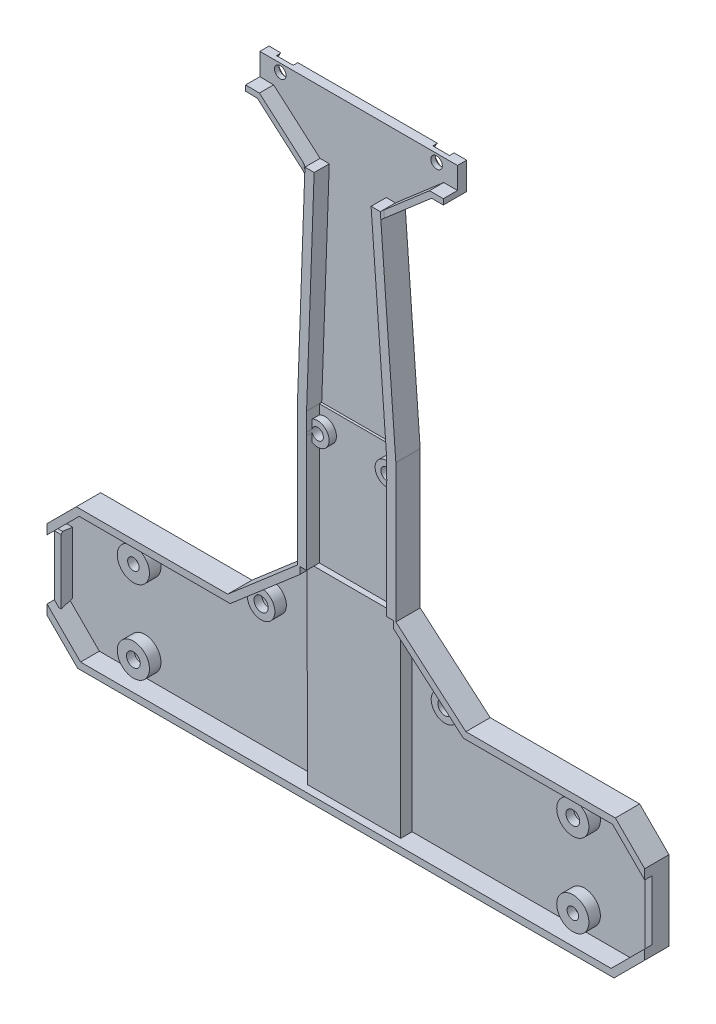
from build123d import *

# Parameters (mm, degrees)
DODANIE_WYCI_GNI_CIE2_DEPTH        = 2.5
DODANIE_WYCI_GNI_CIE2_DEPTH_BACK   = 1.59144
DODANIE_WYCI_GNI_CIE2_2_DEPTH      = 2.5
DODANIE_WYCI_GNI_CIE2_2_DEPTH_BACK = 1.59144
SZKIC2_R                           = 3.5
SZKIC2_R_2                         = 1.49999954
SZKIC2_R_3                         = 1.25000004
SZKIC2_R_4                         = 3
SZKIC2_R_5                         = 1.54999944
DODANIE_WYCI_GNI_CIE3_DEPTH        = 2.5
DODANIE_WYCI_GNI_CIE9_DEPTH        = 1.2
DODANIE_WYCI_GNI_CIE10_DEPTH       = 1.2
WYTNIJ_WYCI_GNI_CIE3_DEPTH         = 6
DODANIE_WYCI_GNI_CIE11_START       = 1.7
DODANIE_WYCI_GNI_CIE11_OUTLINE_R   = 2.25
DODANIE_WYCI_GNI_CIE11_OUTLINE_R_2 = 2.5
DODANIE_WYCI_GNI_CIE11_DEPTH       = 2
DODANIE_WYCI_GNI_CIE11_2_DEPTH     = 3.7
DODANIE_WYCI_GNI_CIE12_OUTLINE_W   = 17.422898441
DODANIE_WYCI_GNI_CIE12_OUTLINE_H   = 1.2
DODANIE_WYCI_GNI_CIE12_DEPTH       = 30
DODANIE_WYCI_GNI_CIE12_2_DEPTH     = 30
DODANIE_WYCI_GNI_CIE13_START       = -5.29144
DODANIE_WYCI_GNI_CIE13_DEPTH       = 5.29144
SZKIC12_R                          = 1.25000004
DODANIE_WYCI_GNI_CIE15_DEPTH       = 2
DODANIE_WYCI_GNI_CIE18_DEPTH       = 2
DODANIE_WYCI_GNI_CIE19_START       = -1
DODANIE_WYCI_GNI_CIE19_OUTLINE_R   = 2.5
DODANIE_WYCI_GNI_CIE19_DEPTH       = 1
DODANIE_WYCI_GNI_CIE19_START_2     = -5.29143954
DODANIE_WYCI_GNI_CIE19_2_OUTLINE_R = 1.25
DODANIE_WYCI_GNI_CIE19_2_DEPTH     = 4.29143954
DODANIE_WYCI_GNI_CIE19_START_3     = -5.09143954
DODANIE_WYCI_GNI_CIE19_3_DEPTH     = 5.09143954
ZAOKR_GLENIE1_R                    = 1
DODANIE_WYCI_GNI_CIE20_START       = -2.5
DODANIE_WYCI_GNI_CIE20_OUTLINE_R   = 1.25000004
DODANIE_WYCI_GNI_CIE20_DEPTH       = 1
DODANIE_WYCI_GNI_CIE20_2_DEPTH     = 1.59143954
DODANIE_WYCI_GNI_CIE23_DEPTH       = 1.5
SZKIC24_W                          = 2.5
SZKIC24_H                          = 15.937417509
DODANIE_WYCI_GNI_CIE24_DEPTH       = 1.5


# Read off the part's stored shape, not the designer's step: Dodanie-wyciągnięcie11, Dodanie-wyciągnięcie12, Dodanie-wyciągnięcie19, Dodanie-wyciągnięcie20
with BuildPart() as part:
    # Szkic1 → Dodanie-wyciągnięcie2 (new, two sides: drawn at the far end of the back side and taken through both)
    with BuildSketch(Plane(origin=(0, 0, -1.59143954), x_dir=(-1, 0, 0), z_dir=(0, 0, -1)).offset(-DODANIE_WYCI_GNI_CIE2_DEPTH_BACK)):
        Polygon((-50.888735278, 24.942136302), (-83.396168618, 24.950154015), (-89.775001526, 18.571321106), (-89.775001526, 16.450000763), (-82.775001526, 23.450000763), (-50.333999634, 23.441999435), (-35.099998474, 36.5), (-14.788999557, 36.5), (0.368999988, 23.441999435), (33.224998474, 23.450000763), (40.224998474, 16.450000763), (40.224998474, 18.571321106), (33.846167502, 24.950152079), (0.925846726, 24.942135087), (-14.231995352, 38), (-35.654893793, 38), align=None)
    extrude(amount=DODANIE_WYCI_GNI_CIE2_DEPTH + DODANIE_WYCI_GNI_CIE2_DEPTH_BACK)

    # Szkic2 → Dodanie-wyciągnięcie3 (add)
    # profile 1 of 8: a face of its own
    with BuildSketch(Plane(origin=(0, 0, -1.59143954), x_dir=(-1, 0, 0), z_dir=(0, 0, -1))):
        with Locations((-72.55100044, 18.79099874)):
            Circle(SZKIC2_R)
        with Locations((-72.55100044, 18.79099874)):
            Circle(SZKIC2_R_2, mode=Mode.SUBTRACT)
    # profile 2 of 8: a face of its own
    with BuildSketch(Plane(origin=(0, 0, -1.59143954), x_dir=(-1, 0, 0), z_dir=(0, 0, -1))):
        with Locations((-72.55100044, 0.79099918)):
            Circle(SZKIC2_R)
        with Locations((-72.55100044, 0.79099918)):
            Circle(SZKIC2_R_3, mode=Mode.SUBTRACT)
    # profile 3 of 8: a face of its own
    with BuildSketch(Plane(origin=(0, 0, -1.59143954), x_dir=(-1, 0, 0), z_dir=(0, 0, -1))):
        with Locations((-44.7499994, 25.6499995)):
            Circle(SZKIC2_R_4)
        with Locations((-44.7499994, 25.6499995)):
            Circle(SZKIC2_R_5, mode=Mode.SUBTRACT)
    # profile 4 of 8: a face of its own
    with BuildSketch(Plane(origin=(0, 0, -1.59143954), x_dir=(-1, 0, 0), z_dir=(0, 0, -1))):
        with Locations((-24.74999876, 34.2750013)):
            Circle(SZKIC2_R_4)
        with Locations((-24.74999876, 34.2750013)):
            Circle(SZKIC2_R_5, mode=Mode.SUBTRACT)
    # profile 5 of 8: a face of its own
    with BuildSketch(Plane(origin=(0, 0, -1.59143954), x_dir=(-1, 0, 0), z_dir=(0, 0, -1))):
        with Locations((-4.75000066, 25.1500005)):
            Circle(SZKIC2_R_4)
        with Locations((-4.75000066, 25.1500005)):
            Circle(SZKIC2_R_5, mode=Mode.SUBTRACT)
    # profile 6 of 8: a face of its own
    with BuildSketch(Plane(origin=(0, 0, -1.59143954), x_dir=(-1, 0, 0), z_dir=(0, 0, -1))):
        with Locations((23.02599916, 18.75899982)):
            Circle(SZKIC2_R)
        with Locations((23.02599916, 18.75899982)):
            Circle(SZKIC2_R_3, mode=Mode.SUBTRACT)
    # profile 7 of 8: a face of its own
    with BuildSketch(Plane(origin=(0, 0, -1.59143954), x_dir=(-1, 0, 0), z_dir=(0, 0, -1))):
        with Locations((23.02599916, 0.75900026)):
            Circle(SZKIC2_R)
        with Locations((23.02599916, 0.75900026)):
            Circle(SZKIC2_R_2, mode=Mode.SUBTRACT)
    # profile 8 of 8: a face of its own
    with BuildSketch(Plane(origin=(0, 0, -1.59143954), x_dir=(-1, 0, 0), z_dir=(0, 0, -1))):
        with Locations((-24.74999876, 5.19999976)):
            Circle(SZKIC2_R_4)
        with Locations((-24.74999876, 5.19999976)):
            Circle(SZKIC2_R_5, mode=Mode.SUBTRACT)
    extrude(amount=DODANIE_WYCI_GNI_CIE3_DEPTH)


with BuildPart() as body_2:
    # Szkic1 → Dodanie-wyci_gni_cie2 2 (new, two sides: drawn at the far end of the back side and taken through both)
    with BuildSketch(Plane(origin=(0, 0, -1.59143954), x_dir=(-1, 0, 0), z_dir=(0, 0, -1)).offset(-DODANIE_WYCI_GNI_CIE2_2_DEPTH_BACK)):
        Polygon((-89.775001526, 1.328680154), (-83.096318631, -5.349999905), (33.546319624, -5.349999905), (40.224998474, 1.3286796), (40.224998474, 3.450000048), (32.924999237, -3.849999905), (-82.474998474, -3.849999905), (-89.775001526, 3.450000048), align=None)
    extrude(amount=DODANIE_WYCI_GNI_CIE2_2_DEPTH + DODANIE_WYCI_GNI_CIE2_2_DEPTH_BACK)



with BuildPart() as dodanie_wyci_gni_cie3_piece_1:
    # of the separate pieces the step leaves, piece 1, a body of its own (dodanie_wyci_gni_cie3_pieces)
    add(part.part.solids().sort_by_distance((50.888735278, 24.942136302, -4.09143954))[0])


with BuildPart() as dodanie_wyci_gni_cie3_piece_2:
    # of the separate pieces the step leaves, piece 2, a body of its own (dodanie_wyci_gni_cie3_pieces)
    add(part.part.solids().sort_by_distance((69.05100044, 0.79099918, -1.59143954))[0])


with BuildPart() as dodanie_wyci_gni_cie3_piece_3:
    # of the separate pieces the step leaves, piece 3, a body of its own (dodanie_wyci_gni_cie3_pieces)
    add(part.part.solids().sort_by_distance((-26.52599916, 18.75899982, -1.59143954))[0])


with BuildPart() as dodanie_wyci_gni_cie3_piece_4:
    # of the separate pieces the step leaves, piece 4, a body of its own (dodanie_wyci_gni_cie3_pieces)
    add(part.part.solids().sort_by_distance((69.05100044, 18.79099874, -1.59143954))[0])


with BuildPart() as dodanie_wyci_gni_cie3_piece_5:
    # of the separate pieces the step leaves, piece 5, a body of its own (dodanie_wyci_gni_cie3_pieces)
    add(part.part.solids().sort_by_distance((-26.52599916, 0.75900026, -1.59143954))[0])


with BuildPart() as dodanie_wyci_gni_cie3_piece_6:
    # of the separate pieces the step leaves, piece 6, a body of its own (dodanie_wyci_gni_cie3_pieces)
    add(part.part.solids().sort_by_distance((21.74999876, 5.19999976, -1.59143954))[0])


with BuildPart() as body_2_1:
    add(body_2.part)

    add(dodanie_wyci_gni_cie3_piece_1.part)  # Dodanie-wyciągnięcie9 merges Dodanie-wyciągnięcie3 piece 1
    # Szkic3 → Dodanie-wyciągnięcie9 (add)
    with BuildSketch(Plane(origin=(0, 0, -4.09143954), x_dir=(-1, 0, 0), z_dir=(0, 0, -1))):
        Polygon((40.224998474, 16.450000763), (40.224998474, 18.571321106), (33.846167502, 24.950152079), (0.925846726, 24.942135087), (-14.231995352, 38), (-35.654893793, 38), (-50.888735278, 24.942136302), (-83.396168618, 24.950154015), (-89.775001526, 18.571321106), (-89.775001526, 16.450000763), (-82.775001526, 23.450000763), (-50.333999634, 23.441999435), (-47.749995418, 25.656908582), (-44.298072293, 28.615764476), (-35.099998474, 36.5), (-26.762306089, 36.5), (-22.737691431, 36.5), (-14.788999557, 36.5), (-5.075577288, 28.132281483), (-1.752380945, 25.269482893), (0.368999988, 23.441999435), (33.224998474, 23.450000763), align=None)
        Polygon((-89.775001526, 3.450000048), (-82.474998474, -3.849999905), (32.924999237, -3.849999905), (40.224998474, 3.450000048), (40.224998474, 1.3286796), (33.546319624, -5.349999905), (-83.096318631, -5.349999905), (-89.775001526, 1.328680154), align=None)
    extrude(amount=DODANIE_WYCI_GNI_CIE9_DEPTH)


    add(dodanie_wyci_gni_cie3_piece_2.part)  # Dodanie-wyciągnięcie10 merges Dodanie-wyciągnięcie3 piece 2

    add(dodanie_wyci_gni_cie3_piece_3.part)  # Dodanie-wyciągnięcie10 merges Dodanie-wyciągnięcie3 piece 3

    add(dodanie_wyci_gni_cie3_piece_4.part)  # Dodanie-wyciągnięcie10 merges Dodanie-wyciągnięcie3 piece 4

    add(dodanie_wyci_gni_cie3_piece_5.part)  # Dodanie-wyciągnięcie10 merges Dodanie-wyciągnięcie3 piece 5

    add(dodanie_wyci_gni_cie3_piece_6.part)  # Dodanie-wyciągnięcie10 merges Dodanie-wyciągnięcie3 piece 6
    # Szkic4 → Dodanie-wyciągnięcie10 (add)
    with BuildSketch(Plane(origin=(0, 0, -5.29143954), x_dir=(-1, 0, 0), z_dir=(0, 0, -1))):
        Polygon((40.224998474, 16.450000763), (40.224998474, 3.450000048), (32.924999237, -3.849999905), (-82.474998474, -3.849999905), (-89.775001526, 3.450000048), (-89.775001526, 16.450000763), (-82.775001526, 23.450000763), (-50.333999634, 23.441999435), (-35.099998474, 36.5), (-14.788999557, 36.5), (0.368999988, 23.441999435), (33.224998474, 23.450000763), align=None)
    extrude(amount=-DODANIE_WYCI_GNI_CIE10_DEPTH)

    # Szkic5 → Wytnij-wyciągnięcie3 (cut)
    with BuildSketch(Plane(origin=(0, 0, -5.29143954), x_dir=(-1, 0, 0), z_dir=(0, 0, -1))):
        Polygon((-14.793379332, -3.849999905), (-14.78792268, 46.421059189), (-35.098921597, 46.421059189), (-35.104378248, -3.849999905), align=None)
    extrude(amount=-WYTNIJ_WYCI_GNI_CIE3_DEPTH, mode=Mode.SUBTRACT)

    # Dodanie-wyciągnięcie11 outline → Dodanie-wyciągnięcie11 (cut)
    with BuildSketch(Plane(origin=(0, 0, -1.59143954), x_dir=(-1, 0, 0), z_dir=(0, 0, -1)).offset(DODANIE_WYCI_GNI_CIE11_START)):
        with Locations((-4.75000066, 25.1500005)):
            Circle(DODANIE_WYCI_GNI_CIE11_OUTLINE_R)
        with Locations((-44.7499994, 25.6499995)):
            Circle(DODANIE_WYCI_GNI_CIE11_OUTLINE_R)
        with Locations((23.02599916, 0.75900026)):
            Circle(DODANIE_WYCI_GNI_CIE11_OUTLINE_R_2)
        with Locations((23.02599916, 18.75899982)):
            Circle(DODANIE_WYCI_GNI_CIE11_OUTLINE_R_2)
        with Locations((-72.55100044, 18.79099874)):
            Circle(DODANIE_WYCI_GNI_CIE11_OUTLINE_R_2)
        with Locations((-72.55100044, 0.79099918)):
            Circle(DODANIE_WYCI_GNI_CIE11_OUTLINE_R_2)
    extrude(amount=DODANIE_WYCI_GNI_CIE11_DEPTH, mode=Mode.SUBTRACT)

    # Dodanie-wyci_gni_cie11 2 outline → Dodanie-wyci_gni_cie11 2 (add)
    with BuildSketch(Plane(origin=(0, 0, -1.59143954), x_dir=(-1, 0, 0), z_dir=(0, 0, -1))):
        Polygon((-35.099998474, 36.5), (-35.104378248, -3.849999905), (-14.793379332, -3.849999905), (-14.788999557, 36.5), (-14.788836741, 38), (-14.788836741, 68), (-35.099835657, 68), (-35.099835657, 38), align=None)
    extrude(amount=DODANIE_WYCI_GNI_CIE11_2_DEPTH)

    # Dodanie-wyciągnięcie12 outline → Dodanie-wyciągnięcie12 (cut)
    with BuildSketch(Plane(origin=(0, 38, 0), x_dir=(1, 0, 0), z_dir=(0, 1, 0))):
        with Locations((24.943444572, 2.19143954)):
            Rectangle(DODANIE_WYCI_GNI_CIE12_OUTLINE_W, DODANIE_WYCI_GNI_CIE12_OUTLINE_H)
    extrude(amount=DODANIE_WYCI_GNI_CIE12_DEPTH, mode=Mode.SUBTRACT)

    # Dodanie-wyci_gni_cie12 2 outline → Dodanie-wyci_gni_cie12 2 (add)
    with BuildSketch(Plane(origin=(0, 38, 0), x_dir=(1, 0, 0), z_dir=(0, 1, 0))):
        Polygon((35.099835657, 1.59143954), (33.654893793, 1.59143954), (33.654893793, 0), (35.654893793, 0), (35.654893793, 5.29143954), (35.099835657, 5.29143954), align=None)
        Polygon((16.231995352, 0), (16.231995352, 1.59143954), (14.788836741, 1.59143954), (14.788836741, 5.29143954), (14.231995352, 5.29143954), (14.231995352, 0), align=None)
    extrude(amount=DODANIE_WYCI_GNI_CIE12_2_DEPTH)

    # Szkic10 → Dodanie-wyciągnięcie13 (add)
    with BuildSketch(Plane(origin=(0, 0, -5.29143954), x_dir=(-1, 0, 0), z_dir=(0, 0, -1)).offset(DODANIE_WYCI_GNI_CIE13_START)):
        Polygon((-35.654893793, 68), (-33.649406791, 68), (-30.269514524, 113.597141796), (-32.275001526, 113.597141796), align=None)
        Polygon((-14.231995352, 68), (-15.879001617, 113.78314262), (-17.879478938, 113.760448644), (-16.233289068, 68), align=None)
    extrude(amount=DODANIE_WYCI_GNI_CIE13_DEPTH)



with BuildPart() as body_2_2:
    # Szkic12 → Dodanie-wyciągnięcie15 (new body)
    with BuildSketch(Plane(origin=(0, 0, -5.29143954), x_dir=(-1, 0, 0), z_dir=(0, 0, -1))):
        Polygon((-42.775001526, 122.683142238), (-45.775001526, 122.683142238), (-45.775001526, 127.397141796), (-2.775001526, 127.397141796), (-2.775001526, 122.614721185), (-5.775001526, 122.583142237), (-15.879001617, 113.78314262), (-32.275001526, 113.597141796), align=None)
        with Locations((-41.218999906, 125.680141578)):
            Circle(SZKIC12_R, mode=Mode.SUBTRACT)
        with Locations((-7.219001866, 125.680141578)):
            Circle(SZKIC12_R, mode=Mode.SUBTRACT)
    extrude(amount=-DODANIE_WYCI_GNI_CIE15_DEPTH)


with BuildPart() as body_2_3:
    add(body_2_1.part)

    add(body_2_2.part)  # Dodanie-wyciągnięcie18 merges body 2 2
    # Szkic15 → Dodanie-wyciągnięcie18 (add)
    with BuildSketch(Plane(origin=(0, 0, -5.29143954), x_dir=(-1, 0, 0), z_dir=(0, 0, -1))):
        Polygon((-32.275001526, 113.597141796), (-15.879001617, 113.78314262), (-14.231995352, 68), (-14.231995352, 64.999139918), (-35.654893793, 64.999139918), (-35.654893793, 68), align=None)
    extrude(amount=-DODANIE_WYCI_GNI_CIE18_DEPTH)

    # Dodanie-wyciągnięcie19 outline → Dodanie-wyciągnięcie19 (cut)
    with BuildSketch(Plane(origin=(0, 0, -5.29143954), x_dir=(-1, 0, 0), z_dir=(0, 0, -1)).offset(DODANIE_WYCI_GNI_CIE19_START)):
        with Locations((-17.439612001, 63.704312654)):
            Circle(DODANIE_WYCI_GNI_CIE19_OUTLINE_R)
        with Locations((-32.439612001, 63.704312636)):
            Circle(DODANIE_WYCI_GNI_CIE19_OUTLINE_R)
    extrude(amount=DODANIE_WYCI_GNI_CIE19_DEPTH, mode=Mode.SUBTRACT)

    # Dodanie-wyci_gni_cie19 2 outline → Dodanie-wyci_gni_cie19 2 (cut)
    with BuildSketch(Plane(origin=(0, 0, -5.29143954), x_dir=(-1, 0, 0), z_dir=(0, 0, -1)).offset(DODANIE_WYCI_GNI_CIE19_START_2)):
        with Locations((-17.439612001, 63.704312654)):
            Circle(DODANIE_WYCI_GNI_CIE19_2_OUTLINE_R)
        with Locations((-32.439612001, 63.704312636)):
            Circle(DODANIE_WYCI_GNI_CIE19_2_OUTLINE_R)
    extrude(amount=DODANIE_WYCI_GNI_CIE19_2_DEPTH, mode=Mode.SUBTRACT)

    # Dodanie-wyci_gni_cie19 3 outline → Dodanie-wyci_gni_cie19 3 (add)
    with BuildSketch(Plane(origin=(0, 0, -5.29143954), x_dir=(-1, 0, 0), z_dir=(0, 0, -1)).offset(DODANIE_WYCI_GNI_CIE19_START_3)):
        Polygon((-42.775001526, 122.683142238), (-45.775001526, 122.683142238), (-45.775001526, 121.483142238), (-43.222120839, 121.483142238), (-32.385540856, 112.105887903), (-32.275001526, 113.597141796), align=None)
        Polygon((-2.775001526, 122.614721185), (-5.775001526, 122.583142237), (-15.879001617, 113.78314262), (-15.823494479, 112.240166566), (-5.320275959, 121.387862342), (-2.762370646, 121.414787661), align=None)
    extrude(amount=DODANIE_WYCI_GNI_CIE19_3_DEPTH)

    # Zaokrąglenie1
    # the kernel refuses this fillet: 1 mm, written as the material it adds along each edge
    with BuildSketch(Plane(origin=(15.932927904, 115.282174492, -0.2), x_dir=(0, 0, 1), z_dir=(-0.03595082103709421, -0.9993535602912309, 0))) as zaokr_glenie1_piece_1_section:
        with BuildLine():
            CenterArc((1, 0.600000613), ZAOKR_GLENIE1_R, 180, 36.869941573)
            Line((0, 0.600000613), (-0.02, 0.600000613))
            Line((-0.02, 0.600000613), (-0.02, 0))
            Line((-0.02, 0), (0, -0.02))
            ThreePointArc((0, -0.02), (0.10000023, -0.02), (0.184000469, -0.012000012))
            Line((0.184000469, -0.012000012), (0.20000046, 0))
        make_face()
    zaokr_glenie1_piece_1 = extrude(amount=4.543977205, mode=Mode.PRIVATE)
    zaokr_glenie1_piece_1 = split(zaokr_glenie1_piece_1, bisect_by=Plane(origin=(15.581229414, 113.786520631, -0.180433138), z_dir=(0.011343550725434725, 0.9999356598586429, 0)), keep=Keep.TOP, mode=Mode.PRIVATE)
    zaokr_glenie1_piece_1 = split(zaokr_glenie1_piece_1, bisect_by=Plane(origin=(15.64669443, 113.985468742, -0.180433138), z_dir=(-0.6567697730652605, -0.7540911517766312, 0)), keep=Keep.TOP, mode=Mode.PRIVATE)
    add(zaokr_glenie1_piece_1)
    with BuildSketch(Plane(origin=(15.932927904, 115.282174492, -0.2), x_dir=(0, 0, 1), z_dir=(-0.03595082103709421, -0.9993535602912309, 0))) as zaokr_glenie1_piece_2_section:
        with BuildLine():
            CenterArc((1, 0.600000613), ZAOKR_GLENIE1_R, 180, 36.869941573)
            Line((0, 0.600000613), (-0.02, 0.600000613))
            Line((-0.02, 0.600000613), (-0.02, 0))
            Line((-0.02, 0), (0, -0.02))
            ThreePointArc((0, -0.02), (0.10000023, -0.02), (0.184000469, -0.012000012))
            Line((0.184000469, -0.012000012), (0.20000046, 0))
        make_face()
    zaokr_glenie1_piece_2 = extrude(amount=4.543977205, mode=Mode.PRIVATE)
    zaokr_glenie1_piece_2 = split(zaokr_glenie1_piece_2, bisect_by=Plane(origin=(15.70491637, 113.785117492, -0.152155867), z_dir=(-0.011343550725434725, -0.9999356598586429, 0)), keep=Keep.TOP, mode=Mode.PRIVATE)
    zaokr_glenie1_piece_2 = split(zaokr_glenie1_piece_2, bisect_by=Plane(origin=(15.336343862, 112.664446574, -0.152155867), z_dir=(0.6567697730647638, 0.7540911517770638, 0)), keep=Keep.TOP, mode=Mode.PRIVATE)
    zaokr_glenie1_piece_2 = split(zaokr_glenie1_piece_2, bisect_by=Plane(origin=(16.12446759, 113.569355956, -0.152155867), z_dir=(-0.6567697730652605, -0.7540911517766312, 0)), keep=Keep.TOP, mode=Mode.PRIVATE)
    add(zaokr_glenie1_piece_2)
    with BuildSketch(Plane(origin=(15.932927904, 115.282174492, -0.2), x_dir=(0, 0, 1), z_dir=(-0.03595082103709421, -0.9993535602912309, 0))) as zaokr_glenie1_piece_3_section:
        with BuildLine():
            CenterArc((1, 0.600000613), ZAOKR_GLENIE1_R, 180, 36.869941573)
            Line((0, 0.600000613), (-0.02, 0.600000613))
            Line((-0.02, 0.600000613), (-0.02, 0))
            Line((-0.02, 0), (0, -0.02))
            ThreePointArc((0, -0.02), (0.10000023, -0.02), (0.184000469, -0.012000012))
            Line((0.184000469, -0.012000012), (0.20000046, 0))
        make_face()
    zaokr_glenie1_piece_3 = extrude(amount=4.543977205, mode=Mode.PRIVATE)
    zaokr_glenie1_piece_3 = split(zaokr_glenie1_piece_3, bisect_by=Plane(origin=(15.89174234, 113.782998086, -0.121949794), z_dir=(-0.011343550725434725, -0.9999356598586429, 0)), keep=Keep.TOP, mode=Mode.PRIVATE)
    zaokr_glenie1_piece_3 = split(zaokr_glenie1_piece_3, bisect_by=Plane(origin=(15.888941301, 113.774485731, -0.121949794), z_dir=(0.6567697730652605, 0.7540911517766312, 0)), keep=Keep.TOP, mode=Mode.PRIVATE)
    add(zaokr_glenie1_piece_3)
    with BuildSketch(Plane(origin=(32.496424396, 110.609990367, -0.2), x_dir=(0, 0, 1), z_dir=(-0.07392228477745476, 0.9972640050725189, 0))) as zaokr_glenie1_piece_4_section:
        with BuildLine():
            CenterArc((1, 0.600000613), ZAOKR_GLENIE1_R, 180, 36.869941573)
            Line((0, 0.600000613), (-0.02, 0.600000613))
            Line((-0.02, 0.600000613), (-0.02, 0))
            Line((-0.02, 0), (0, -0.02))
            ThreePointArc((0, -0.02), (0.10000023, -0.02), (0.184000469, -0.012000012))
            Line((0.184000469, -0.012000012), (0.20000046, 0))
        make_face()
    zaokr_glenie1_piece_4 = extrude(amount=4.495348216, mode=Mode.PRIVATE)
    zaokr_glenie1_piece_4 = split(zaokr_glenie1_piece_4, bisect_by=Plane(origin=(32.841333783, 112.500300735, -0.152121376), z_dir=(-0.6543545889590161, 0.7561878549066211, 0)), keep=Keep.TOP, mode=Mode.PRIVATE)
    zaokr_glenie1_piece_4 = split(zaokr_glenie1_piece_4, bisect_by=Plane(origin=(32.482467049, 113.597141796, -0.152121376), z_dir=(0, -1, 0)), keep=Keep.TOP, mode=Mode.PRIVATE)
    zaokr_glenie1_piece_4 = split(zaokr_glenie1_piece_4, bisect_by=Plane(origin=(32.056108276, 113.407726161, -0.152121376), z_dir=(0.6543545889506797, -0.756187854913835, 0)), keep=Keep.TOP, mode=Mode.PRIVATE)
    add(zaokr_glenie1_piece_4)
    with BuildSketch(Plane(origin=(32.496424396, 110.609990367, -0.2), x_dir=(0, 0, 1), z_dir=(-0.07392228477745476, 0.9972640050725189, 0))) as zaokr_glenie1_piece_5_section:
        with BuildLine():
            CenterArc((1, 0.600000613), ZAOKR_GLENIE1_R, 180, 36.869941573)
            Line((0, 0.600000613), (-0.02, 0.600000613))
            Line((-0.02, 0.600000613), (-0.02, 0))
            Line((-0.02, 0), (0, -0.02))
            ThreePointArc((0, -0.02), (0.10000023, -0.02), (0.184000469, -0.012000012))
            Line((0.184000469, -0.012000012), (0.20000046, 0))
        make_face()
    zaokr_glenie1_piece_5 = extrude(amount=4.495348216, mode=Mode.PRIVATE)
    zaokr_glenie1_piece_5 = split(zaokr_glenie1_piece_5, bisect_by=Plane(origin=(32.567524751, 113.597141796, -0.180433137), z_dir=(0, 1, 0)), keep=Keep.TOP, mode=Mode.PRIVATE)
    zaokr_glenie1_piece_5 = split(zaokr_glenie1_piece_5, bisect_by=Plane(origin=(32.502952363, 113.794395263, -0.180433137), z_dir=(0.6543545889506797, -0.756187854913835, 0)), keep=Keep.TOP, mode=Mode.PRIVATE)
    add(zaokr_glenie1_piece_5)
    with BuildSketch(Plane(origin=(32.496424396, 110.609990367, -0.2), x_dir=(0, 0, 1), z_dir=(-0.07392228477745476, 0.9972640050725189, 0))) as zaokr_glenie1_piece_6_section:
        with BuildLine():
            CenterArc((1, 0.600000613), ZAOKR_GLENIE1_R, 180, 36.869941573)
            Line((0, 0.600000613), (-0.02, 0.600000613))
            Line((-0.02, 0.600000613), (-0.02, 0))
            Line((-0.02, 0), (0, -0.02))
            ThreePointArc((0, -0.02), (0.10000023, -0.02), (0.184000469, -0.012000012))
            Line((0.184000469, -0.012000012), (0.20000046, 0))
        make_face()
    zaokr_glenie1_piece_6 = extrude(amount=4.495348216, mode=Mode.PRIVATE)
    zaokr_glenie1_piece_6 = split(zaokr_glenie1_piece_6, bisect_by=Plane(origin=(32.262485391, 113.597141796, -0.121949792), z_dir=(0, -1, 0)), keep=Keep.TOP, mode=Mode.PRIVATE)
    zaokr_glenie1_piece_6 = split(zaokr_glenie1_piece_6, bisect_by=Plane(origin=(32.265248237, 113.58870195, -0.121949792), z_dir=(-0.6543545889506797, 0.756187854913835, 0)), keep=Keep.TOP, mode=Mode.PRIVATE)
    add(zaokr_glenie1_piece_6)

    # Dodanie-wyciągnięcie20 outline → Dodanie-wyciągnięcie20 (cut)
    # profile 1 of 2: a face of its own
    with BuildSketch(Plane.XY.offset(-2.79143954).offset(DODANIE_WYCI_GNI_CIE20_START)):
        with BuildLine():
            Line((43.036115822, 127.397141796), (39.40188399, 127.397141796))
            ThreePointArc((39.40188399, 127.397141796), (41.218999906, 123.180141578), (43.036115822, 127.397141796))
        make_face()
        with Locations((41.218999906, 125.680141578)):
            Circle(DODANIE_WYCI_GNI_CIE20_OUTLINE_R, mode=Mode.SUBTRACT)
    # profile 2 of 2: a face of its own
    with BuildSketch(Plane.XY.offset(-2.79143954).offset(DODANIE_WYCI_GNI_CIE20_START)):
        with BuildLine():
            ThreePointArc((5.40188595, 127.397141796), (7.219001866, 123.180141578), (9.036117782, 127.397141796))
            Line((9.036117782, 127.397141796), (5.40188595, 127.397141796))
        make_face()
        with Locations((7.219001866, 125.680141578)):
            Circle(DODANIE_WYCI_GNI_CIE20_OUTLINE_R, mode=Mode.SUBTRACT)
    extrude(amount=DODANIE_WYCI_GNI_CIE20_DEPTH, mode=Mode.SUBTRACT)

    # Dodanie-wyci_gni_cie20 2 outline → Dodanie-wyci_gni_cie20 2 (add)
    with BuildSketch(Plane.XY.offset(-2.79143954)):
        with BuildLine():
            ThreePointArc((16.231995352, 64.027054083), (18.689612001, 63.704312654), (16.231995352, 63.381571225))
            Line((16.231995352, 63.381571225), (16.231995352, 61.515326124))
            ThreePointArc((16.231995352, 61.515326124), (19.939612001, 63.704312654), (16.231995352, 65.893299184))
            Line((16.231995352, 65.893299184), (16.231995352, 64.027054083))
        make_face()
        with BuildLine():
            ThreePointArc((33.654893793, 63.411754667), (31.189612001, 63.704312636), (33.654893793, 63.996870606))
            Line((33.654893793, 63.996870606), (33.654893793, 65.889052933))
            ThreePointArc((33.654893793, 65.889052933), (29.939612001, 63.704312636), (33.654893793, 61.519572339))
            Line((33.654893793, 61.519572339), (33.654893793, 63.411754667))
        make_face()
    extrude(amount=DODANIE_WYCI_GNI_CIE20_2_DEPTH)

    # Szkic23 → Dodanie-wyciągnięcie23 (add)
    with BuildSketch(Plane.ZY.offset(40.224998474)):
        Polygon((-1.592552119, 16.450000763), (-1.592552119, 2.451060843), (-4.697948833, 3.450000048), (-4.697948833, 16.742517446), (-4.09143954, 16.60111914), (-1.854451942, 16.945074287), align=None)
    extrude(amount=-DODANIE_WYCI_GNI_CIE23_DEPTH)

    # Szkic24 → Dodanie-wyciągnięcie24 (add)
    with BuildSketch(Plane(origin=(89.775001526, 0, 0), x_dir=(0, 0, -1), z_dir=(1, 0, 0))):
        with Locations((2.84143954, 10.066360623)):
            Rectangle(SZKIC24_W, SZKIC24_H)
    extrude(amount=-DODANIE_WYCI_GNI_CIE24_DEPTH)


solid = body_2_3.part
